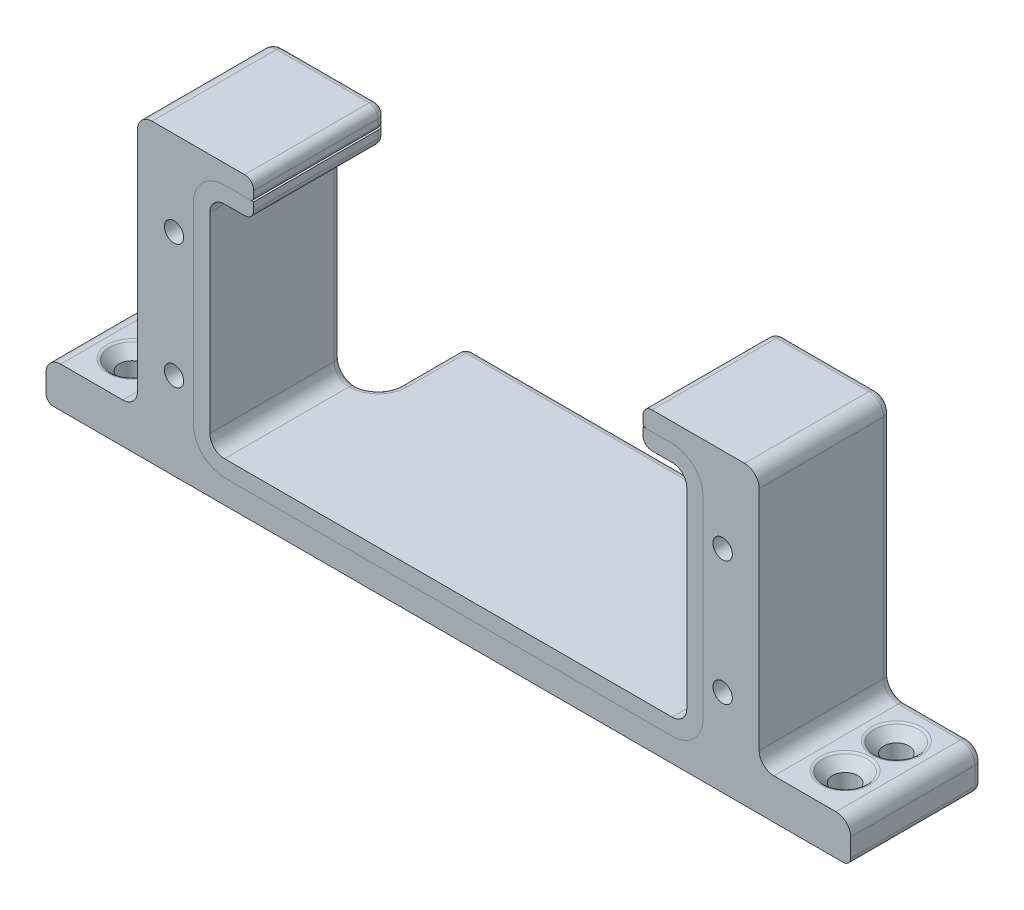
from build123d import *

# Parameters (mm, degrees)
SKETCH1_R                           = 1.325
BOSS_EXTRUDE1_DEPTH                 = 9
SKETCH2_W                           = 18
SKETCH2_H                           = 5.5
BOSS_EXTRUDE2_DEPTH                 = 55
TAP_DRILL_FOR_8_32_TAP1_D           = 3.4544
TAP_DRILL_FOR_8_32_TAP1_CSINK_D     = 6.35
TAP_DRILL_FOR_8_32_TAP1_CSINK_ANGLE = 90
MIRROR2_COPY_1_D                    = 3.4544
MIRROR2_COPY_1_CSINK_D              = 6.35
MIRROR2_COPY_1_CSINK_ANGLE          = 90
SKETCH6_W                           = 18
SKETCH6_H                           = 4.85
BOSS_EXTRUDE3_DEPTH                 = 6
SKETCH7_W                           = 55.2
SKETCH7_H                           = 5.5
BOSS_EXTRUDE4_DEPTH                 = 12
SKETCH9_R                           = 1.7272
BOSS_EXTRUDE5_DEPTH                 = 5
FILLET4_R                           = 3
FILLET1_R                           = 2
FILLET5_R                           = 1.25
FILLET2_R                           = 1
FILLET6_R                           = 1
SPLIT1_SURFACE_1_BACK               = 123.798
SPLIT1_SURFACE_1_DEPTH              = 247.596
SPLIT1_SURFACE_2_BACK               = 123.798
SPLIT1_SURFACE_2_DEPTH              = 247.596
FILLET7_R                           = 2
FILLET8_R                           = 0.5
FILLET9_R                           = 0.5
FILLET10_R                          = 0.5
CHAMFER1_SIZE                       = 0.5


with BuildPart() as part:
    # Sketch1 → Boss-Extrude1 (new, symmetric)
    with BuildSketch(Plane.XY):
        Polygon((-42.5, -20.25), (42.5, -20.25), (42.5, 20.25), (32.6, 20.25), (32.6, -14.75), (-32.6, -14.75), (-32.6, 20.25), (-42.5, 20.25), align=None)
        with Locations((-37.5, 8.649817683)):
            Circle(SKETCH1_R, mode=Mode.SUBTRACT)
        with Locations((-37.5, -8.350182317)):
            Circle(SKETCH1_R, mode=Mode.SUBTRACT)
        with Locations(Location((37.5, -8.350182317, 0), (0, 0, 180))):
            Circle(SKETCH1_R, mode=Mode.SUBTRACT)
        with Locations(Location((37.5, 8.649817683, 0), (0, 0, 180))):
            Circle(SKETCH1_R, mode=Mode.SUBTRACT)
    extrude(amount=BOSS_EXTRUDE1_DEPTH, both=True)

    # Sketch2 → Boss-Extrude2 (add, symmetric)
    with BuildSketch(Plane(origin=(0, 0, 0), x_dir=(0, 0, -1), z_dir=(1, 0, 0))):
        with Locations((0, -17.5)):
            Rectangle(SKETCH2_W, SKETCH2_H)
    extrude(amount=BOSS_EXTRUDE2_DEPTH, both=True)

    # Tap Drill for #8-32 Tap1 (through all)
    with Locations(Plane(origin=(-48.75, -14.75, -3.5), x_dir=(0, 0, 1), z_dir=(0, 1, 0))):
        with Locations((0, 0)):
            tap_drill_for_8_32_tap1 = CounterSinkHole(TAP_DRILL_FOR_8_32_TAP1_D / 2, TAP_DRILL_FOR_8_32_TAP1_CSINK_D / 2, counter_sink_angle=TAP_DRILL_FOR_8_32_TAP1_CSINK_ANGLE)

    # Mirror1: Tap Drill for #8-32 Tap1 across plane
    add(tap_drill_for_8_32_tap1.mirror(Plane.XY), mode=Mode.SUBTRACT)

    # Mirror2: Tap Drill for #8-32 Tap1 across plane
    add(tap_drill_for_8_32_tap1.mirror(Plane(origin=(0, 0, 0), x_dir=(0, 0, 1), z_dir=(1, 0, 0))), mode=Mode.SUBTRACT)

    # Mirror2 copy 1 (through all)
    with Locations(Plane(origin=(48.75, -14.75, 3.5), x_dir=(0, 0, -1), z_dir=(0, 1, 0))):
        with Locations((0, 0)):
            CounterSinkHole(MIRROR2_COPY_1_D / 2, MIRROR2_COPY_1_CSINK_D / 2, counter_sink_angle=MIRROR2_COPY_1_CSINK_ANGLE)

    # Sketch6 → Boss-Extrude3 (add)
    with BuildSketch(Plane(origin=(-32.6, 0, 0), x_dir=(0, 0, -1), z_dir=(1, 0, 0))):
        with Locations((0, 17.825)):
            Rectangle(SKETCH6_W, SKETCH6_H)
    boss_extrude3 = extrude(amount=BOSS_EXTRUDE3_DEPTH)

    # Mirror3: Boss-Extrude3 across plane
    add(boss_extrude3.mirror(Plane(origin=(0, 0, 0), x_dir=(0, 0, 1), z_dir=(1, 0, 0))))

    # Sketch7 → Boss-Extrude4 (add)
    with BuildSketch(Plane(origin=(0, 0, -9), x_dir=(-1, 0, 0), z_dir=(0, 0, -1))):
        with Locations((0, -17.5)):
            Rectangle(SKETCH7_W, SKETCH7_H)
    extrude(amount=BOSS_EXTRUDE4_DEPTH)

    # Fillet4
    fillet4_edges = [part.edges().sort_by_distance(p)[0] for p in [
        (27.6, -17.5, -9),
        (-27.6, -17.5, -9),
    ]]
    fillet(fillet4_edges, radius=FILLET4_R)

    # Fillet1
    fillet1_edges = [part.edges().sort_by_distance(p)[0] for p in [
        (32.6, 15.4, 0),
        (42.5, 20.25, 0),
        (-42.5, 20.25, 0),
        (-32.6, -14.75, 0),
        (32.6, -14.75, 0),
        (-42.5, -14.75, 0),
        (-55, -14.75, 0),
        (42.5, -14.75, 0),
        (55, -14.75, 0),
        (-32.6, 15.4, 0),
    ]]
    fillet(fillet1_edges, radius=FILLET1_R)

    # Fillet5
    fillet5_edges = [part.edges().sort_by_distance(p)[0] for p in [
        (26.6, 20.25, 0),
        (26.6, 15.4, 0),
        (-26.6, 15.4, 0),
        (-26.6, 20.25, 0),
    ]]
    fillet(fillet5_edges, radius=FILLET5_R)

    # Fillet2
    fillet2_edges = [part.edges().sort_by_distance(p)[0] for p in [
        (-27.6, -20.25, -16.5),
        (0, -14.75, -21),
        (-28.478679656, -20.25, -9.878679656),
        (-42.8, -20.25, -9),
        (-55, -20.25, 0),
        (55, -20.25, 0),
    ]]
    fillet(fillet2_edges, radius=FILLET2_R)

    # Fillet6
    # the kernel refuses this fillet: 1 mm, written as the material it takes off along each edge
    with BuildSketch(Plane(origin=(-54, -19.25, -8), x_dir=(-1, 0, 0), z_dir=(0, 0, -1))) as fillet6_piece_1_section:
        Polygon((0, 0), (FILLET6_R, 0), (FILLET6_R, -FILLET6_R), (0, -FILLET6_R), align=None)
    fillet6_piece_1 = extrude(amount=FILLET6_R, mode=Mode.PRIVATE)
    fillet6_piece_1 = fillet6_piece_1 - Plane(origin=(-54, -19.25, -8), x_dir=(0.7071067811865475, 0.7071067811865475, 0), z_dir=(0, 0, -1)) * Sphere(FILLET6_R, mode=Mode.PRIVATE)
    add(fillet6_piece_1, mode=Mode.SUBTRACT)
    with BuildSketch(Plane(origin=(26.6, -19.25, -20), x_dir=(0, -1, 0), z_dir=(0, 0, -1))) as fillet6_piece_2_section:
        Polygon((0, 0), (FILLET6_R, 0), (FILLET6_R, -FILLET6_R), (0, -FILLET6_R), align=None)
    fillet6_piece_2 = extrude(amount=FILLET6_R, mode=Mode.PRIVATE)
    fillet6_piece_2 = fillet6_piece_2 - Plane(origin=(26.6, -19.25, -20), x_dir=(-0.7071067811865475, 0.7071067811865475, 0), z_dir=(0, 0, -1)) * Sphere(FILLET6_R, mode=Mode.PRIVATE)
    add(fillet6_piece_2, mode=Mode.SUBTRACT)
    with BuildSketch(Plane(origin=(27.6, -20.25, -12), x_dir=(-1, 0, 0), z_dir=(0, 0, -1)), Plane(origin=(-27.6, -14.75, -12), x_dir=(1, 0, 0), z_dir=(0, 0, -1))) as fillet6_piece_3:
        with BuildLine():
            CenterArc((FILLET6_R, FILLET6_R), FILLET6_R, 180, 90)
            Line((0, FILLET6_R), (0, 0))
            Line((0, 0), (FILLET6_R, 0))
        make_face()
    extrude(amount=8, mode=Mode.SUBTRACT)
    with BuildSketch(Plane(origin=(-26.6, -20.25, -21), x_dir=(0, 0, 1), z_dir=(1, 0, 0))) as fillet6_piece_4:
        with BuildLine():
            CenterArc((FILLET6_R, -FILLET6_R), FILLET6_R, 90, 90)
            Line((0, -FILLET6_R), (0, 0))
            Line((0, 0), (FILLET6_R, 0))
        make_face()
    extrude(amount=53.2, mode=Mode.SUBTRACT)
    with BuildSketch(Plane(origin=(30.6, -20.25, -9), x_dir=(0, 0, 1), z_dir=(1, 0, 0))) as fillet6_piece_5:
        with BuildLine():
            CenterArc((FILLET6_R, -FILLET6_R), FILLET6_R, 90, 90)
            Line((0, -FILLET6_R), (0, 0))
            Line((0, 0), (FILLET6_R, 0))
        make_face()
    extrude(amount=23.4, mode=Mode.SUBTRACT)
    with BuildSketch(Plane(origin=(30.6, -20.25, -12), x_dir=(0, 0, 1), z_dir=(1, 0, 0))) as fillet6_piece_6:
        with BuildLine():
            CenterArc((3 + FILLET6_R, -FILLET6_R), FILLET6_R, 90, 90)
            Line((3, -FILLET6_R), (3, 0))
            Line((3, 0), (3 + FILLET6_R, 0))
        make_face()
    revolve(axis=Axis((30.6, -20.25, -12), (0, -1, 0)), revolution_arc=90, mode=Mode.SUBTRACT)
    with BuildSketch(Plane(origin=(30.6, -14.75, -12), x_dir=(0, 0, 1), z_dir=(1, 0, 0))) as fillet6_piece_7:
        with BuildLine():
            CenterArc((3 + FILLET6_R, FILLET6_R), FILLET6_R, 180, 90)
            Line((3, FILLET6_R), (3, 0))
            Line((3, 0), (3 + FILLET6_R, 0))
        make_face()
    revolve(axis=Axis((30.6, -14.75, -12), (0, -1, 0)), revolution_arc=90, mode=Mode.SUBTRACT)
    with BuildSketch(Plane(origin=(-30.6, -14.75, -12), x_dir=(0, 0, 1), z_dir=(-1, 0, 0))) as fillet6_piece_8:
        with BuildLine():
            CenterArc((3 + FILLET6_R, -FILLET6_R), FILLET6_R, 90, 90)
            Line((3 + FILLET6_R, 0), (3, 0))
            Line((3, 0), (3, -FILLET6_R))
        make_face()
    revolve(axis=Axis((-30.6, -14.75, -12), (0, 1, 0)), revolution_arc=90, mode=Mode.SUBTRACT)
    with BuildSketch(Plane(origin=(-32.6, -12.75, -9), x_dir=(-1, 0, 0), z_dir=(0, 1, 0))) as fillet6_piece_9:
        with BuildLine():
            CenterArc((FILLET6_R, FILLET6_R), FILLET6_R, 180, 90)
            Line((0, FILLET6_R), (0, 0))
            Line((0, 0), (FILLET6_R, 0))
        make_face()
    extrude(amount=26.15, mode=Mode.SUBTRACT)
    with BuildSketch(Plane(origin=(32.6, 13.4, -9), x_dir=(0, 0, 1), z_dir=(0, -1, 0))) as fillet6_piece_10:
        with BuildLine():
            CenterArc((FILLET6_R, -FILLET6_R), FILLET6_R, 90, 90)
            Line((0, -FILLET6_R), (0, 0))
            Line((0, 0), (FILLET6_R, 0))
        make_face()
    extrude(amount=26.15, mode=Mode.SUBTRACT)
    with BuildSketch(Plane(origin=(44.5, -14.75, -9), x_dir=(0, 0, 1), z_dir=(1, 0, 0))) as fillet6_piece_11:
        with BuildLine():
            CenterArc((FILLET6_R, FILLET6_R), FILLET6_R, 180, 90)
            Line((0, FILLET6_R), (0, 0))
            Line((0, 0), (FILLET6_R, 0))
        make_face()
    extrude(amount=8.5, mode=Mode.SUBTRACT)
    with BuildSketch(Plane(origin=(27.85, 20.25, -9), x_dir=(0, 0, 1), z_dir=(1, 0, 0))) as fillet6_piece_12:
        with BuildLine():
            CenterArc((FILLET6_R, FILLET6_R), FILLET6_R, 180, 90)
            Line((0, FILLET6_R), (0, 0))
            Line((0, 0), (FILLET6_R, 0))
        make_face()
    extrude(amount=12.65, mode=Mode.SUBTRACT)
    with BuildSketch(Plane(origin=(42.5, -12.75, -9), x_dir=(0, 0, 1), z_dir=(0, 1, 0))) as fillet6_piece_13:
        with BuildLine():
            CenterArc((FILLET6_R, -FILLET6_R), FILLET6_R, 90, 90)
            Line((0, -FILLET6_R), (0, 0))
            Line((0, 0), (FILLET6_R, 0))
        make_face()
    extrude(amount=31, mode=Mode.SUBTRACT)
    with BuildSketch(Plane(origin=(40.5, 18.25, -9), x_dir=(1, 0, 0), z_dir=(0, -1, 0))) as fillet6_piece_14:
        with BuildLine():
            CenterArc((2 - FILLET6_R, FILLET6_R), FILLET6_R, 270, 90)
            Line((2 - FILLET6_R, 0), (2, 0))
            Line((2, 0), (2, FILLET6_R))
        make_face()
    revolve(axis=Axis((40.5, 18.25, -9), (0, 0, 1)), revolution_arc=90, mode=Mode.SUBTRACT)
    with BuildSketch(Plane(origin=(53, -16.75, -9), x_dir=(1, 0, 0), z_dir=(0, -1, 0))) as fillet6_piece_15:
        with BuildLine():
            CenterArc((2 - FILLET6_R, FILLET6_R), FILLET6_R, 270, 90)
            Line((2 - FILLET6_R, 0), (2, 0))
            Line((2, 0), (2, FILLET6_R))
        make_face()
    revolve(axis=Axis((53, -16.75, -9), (0, 0, 1)), revolution_arc=90, mode=Mode.SUBTRACT)
    with BuildSketch(Plane(origin=(-53, -14.75, -9), x_dir=(0, -1, 0), z_dir=(1, 0, 0))) as fillet6_piece_16:
        with BuildLine():
            CenterArc((FILLET6_R, -FILLET6_R), FILLET6_R, 90, 90)
            Line((0, -FILLET6_R), (0, 0))
            Line((0, 0), (FILLET6_R, 0))
        make_face()
    extrude(amount=8.5, mode=Mode.SUBTRACT)
    with BuildSketch(Plane(origin=(-42.5, 18.25, -9), x_dir=(1, 0, 0), z_dir=(0, -1, 0))) as fillet6_piece_17:
        with BuildLine():
            CenterArc((FILLET6_R, FILLET6_R), FILLET6_R, 180, 90)
            Line((0, FILLET6_R), (0, 0))
            Line((0, 0), (FILLET6_R, 0))
        make_face()
    extrude(amount=31, mode=Mode.SUBTRACT)
    with BuildSketch(Plane(origin=(-40.5, 18.25, -9), x_dir=(-1, 0, 0), z_dir=(0, -1, 0))) as fillet6_piece_18:
        with BuildLine():
            CenterArc((2 - FILLET6_R, -FILLET6_R), FILLET6_R, 0, 90)
            Line((2, -FILLET6_R), (2, 0))
            Line((2, 0), (2 - FILLET6_R, 0))
        make_face()
    revolve(axis=Axis((-40.5, 18.25, -9), (0, 0, -1)), revolution_arc=90, mode=Mode.SUBTRACT)
    with BuildSketch(Plane(origin=(-53, -16.75, -9), x_dir=(-1, 0, 0), z_dir=(0, -1, 0))) as fillet6_piece_19:
        with BuildLine():
            CenterArc((2 - FILLET6_R, -FILLET6_R), FILLET6_R, 0, 90)
            Line((2, -FILLET6_R), (2, 0))
            Line((2, 0), (2 - FILLET6_R, 0))
        make_face()
    revolve(axis=Axis((-53, -16.75, -9), (0, 0, -1)), revolution_arc=90, mode=Mode.SUBTRACT)
    with BuildSketch(Plane(origin=(-30.6, -12.75, -9), x_dir=(0, -1, 0), z_dir=(1, 0, 0))) as fillet6_piece_20:
        with BuildLine():
            CenterArc((2 + FILLET6_R, -FILLET6_R), FILLET6_R, 90, 90)
            Line((2, -FILLET6_R), (2, 0))
            Line((2, 0), (2 + FILLET6_R, 0))
        make_face()
    revolve(axis=Axis((-30.6, -12.75, -9), (0, 0, -1)), revolution_arc=90, mode=Mode.SUBTRACT)
    with BuildSketch(Plane(origin=(-30.6, 13.4, -9), x_dir=(-1, 0, 0), z_dir=(0, -1, 0))) as fillet6_piece_21:
        with BuildLine():
            CenterArc((2 + FILLET6_R, -FILLET6_R), FILLET6_R, 90, 90)
            Line((2, -FILLET6_R), (2, 0))
            Line((2, 0), (2 + FILLET6_R, 0))
        make_face()
    revolve(axis=Axis((-30.6, 13.4, -9), (0, 0, -1)), revolution_arc=90, mode=Mode.SUBTRACT)
    with BuildSketch(Plane(origin=(30.6, 13.4, -9), x_dir=(0, 1, 0), z_dir=(-1, 0, 0))) as fillet6_piece_22:
        with BuildLine():
            CenterArc((2 + FILLET6_R, -FILLET6_R), FILLET6_R, 90, 90)
            Line((2 + FILLET6_R, 0), (2, 0))
            Line((2, 0), (2, -FILLET6_R))
        make_face()
    revolve(axis=Axis((30.6, 13.4, -9), (0, 0, -1)), revolution_arc=90, mode=Mode.SUBTRACT)
    with BuildSketch(Plane(origin=(30.6, -12.75, -9), x_dir=(0, -1, 0), z_dir=(-1, 0, 0))) as fillet6_piece_23:
        with BuildLine():
            CenterArc((2 + FILLET6_R, FILLET6_R), FILLET6_R, 180, 90)
            Line((2 + FILLET6_R, 0), (2, 0))
            Line((2, 0), (2, FILLET6_R))
        make_face()
    revolve(axis=Axis((30.6, -12.75, -9), (0, 0, 1)), revolution_arc=90, mode=Mode.SUBTRACT)
    with BuildSketch(Plane(origin=(44.5, -12.75, -9), x_dir=(0, -1, 0), z_dir=(1, 0, 0))) as fillet6_piece_24:
        with BuildLine():
            CenterArc((2 + FILLET6_R, -FILLET6_R), FILLET6_R, 90, 90)
            Line((2 + FILLET6_R, 0), (2, 0))
            Line((2, 0), (2, -FILLET6_R))
        make_face()
    revolve(axis=Axis((44.5, -12.75, -9), (0, 0, -1)), revolution_arc=90, mode=Mode.SUBTRACT)
    with BuildSketch(Plane(origin=(-44.5, -12.75, -9), x_dir=(0, -1, 0), z_dir=(-1, 0, 0))) as fillet6_piece_25:
        with BuildLine():
            CenterArc((2 + FILLET6_R, FILLET6_R), FILLET6_R, 180, 90)
            Line((2, FILLET6_R), (2, 0))
            Line((2, 0), (2 + FILLET6_R, 0))
        make_face()
    revolve(axis=Axis((-44.5, -12.75, -9), (0, 0, 1)), revolution_arc=90, mode=Mode.SUBTRACT)
    with BuildSketch(Plane(origin=(-26.6, 19, -9), x_dir=(-1, 0, 0), z_dir=(0, -1, 0)), Plane(origin=(26.6, 19, -9), x_dir=(0, 0, 1), z_dir=(0, -1, 0))) as fillet6_piece_26:
        with BuildLine():
            CenterArc((FILLET6_R, -FILLET6_R), FILLET6_R, 90, 90)
            Line((0, -FILLET6_R), (0, 0))
            Line((0, 0), (FILLET6_R, 0))
        make_face()
    extrude(amount=2.35, mode=Mode.SUBTRACT)
    with BuildSketch(Plane(origin=(-40.5, 20.25, -9), x_dir=(0, -1, 0), z_dir=(1, 0, 0))) as fillet6_piece_27:
        with BuildLine():
            CenterArc((FILLET6_R, -FILLET6_R), FILLET6_R, 90, 90)
            Line((0, -FILLET6_R), (0, 0))
            Line((0, 0), (FILLET6_R, 0))
        make_face()
    extrude(amount=12.65, mode=Mode.SUBTRACT)
    with BuildSketch(Plane(origin=(-30.6, 15.4, -9), x_dir=(0, 1, 0), z_dir=(1, 0, 0)), Plane(origin=(30.6, 15.4, -9), x_dir=(0, 0, 1), z_dir=(-1, 0, 0))) as fillet6_piece_28:
        with BuildLine():
            CenterArc((FILLET6_R, FILLET6_R), FILLET6_R, 180, 90)
            Line((0, FILLET6_R), (0, 0))
            Line((0, 0), (FILLET6_R, 0))
        make_face()
    extrude(amount=2.75, mode=Mode.SUBTRACT)
    with BuildSketch(Plane(origin=(-27.85, 19, -9), x_dir=(0, 1, 0), z_dir=(-1, 0, 0))) as fillet6_piece_29:
        with BuildLine():
            CenterArc((1.25 - FILLET6_R, -FILLET6_R), FILLET6_R, 0, 90)
            Line((1.25, -FILLET6_R), (1.25, 0))
            Line((1.25, 0), (1.25 - FILLET6_R, 0))
        make_face()
    revolve(axis=Axis((-27.85, 19, -9), (0, 0, -1)), revolution_arc=90, mode=Mode.SUBTRACT)
    with BuildSketch(Plane(origin=(-27.85, 16.65, -9), x_dir=(0, -1, 0), z_dir=(-1, 0, 0))) as fillet6_piece_30:
        with BuildLine():
            CenterArc((1.25 - FILLET6_R, FILLET6_R), FILLET6_R, 270, 90)
            Line((1.25, FILLET6_R), (1.25, 0))
            Line((1.25, 0), (1.25 - FILLET6_R, 0))
        make_face()
    revolve(axis=Axis((-27.85, 16.65, -9), (0, 0, 1)), revolution_arc=90, mode=Mode.SUBTRACT)
    with BuildSketch(Plane(origin=(27.85, 19, -9), x_dir=(-1, 0, 0), z_dir=(0, -1, 0))) as fillet6_piece_31:
        with BuildLine():
            CenterArc((1.25 - FILLET6_R, -FILLET6_R), FILLET6_R, 0, 90)
            Line((1.25 - FILLET6_R, 0), (1.25, 0))
            Line((1.25, 0), (1.25, -FILLET6_R))
        make_face()
    revolve(axis=Axis((27.85, 19, -9), (0, 0, -1)), revolution_arc=90, mode=Mode.SUBTRACT)
    with BuildSketch(Plane(origin=(27.85, 16.65, -9), x_dir=(0, -1, 0), z_dir=(1, 0, 0))) as fillet6_piece_32:
        with BuildLine():
            CenterArc((1.25 - FILLET6_R, -FILLET6_R), FILLET6_R, 0, 90)
            Line((1.25 - FILLET6_R, 0), (1.25, 0))
            Line((1.25, 0), (1.25, -FILLET6_R))
        make_face()
    revolve(axis=Axis((27.85, 16.65, -9), (0, 0, -1)), revolution_arc=90, mode=Mode.SUBTRACT)
    with BuildSketch(Plane(origin=(-27.6, -15.75, -21), x_dir=(0, 0, 1), z_dir=(0, -1, 0)), Plane(origin=(27.6, -19.25, -21), x_dir=(0, 0, 1), z_dir=(0, 1, 0))) as fillet6_piece_33:
        with BuildLine():
            CenterArc((FILLET6_R, -FILLET6_R), FILLET6_R, 90, 90)
            Line((0, -FILLET6_R), (0, 0))
            Line((0, 0), (FILLET6_R, 0))
        make_face()
    extrude(amount=3.5, mode=Mode.SUBTRACT)
    with BuildSketch(Plane(origin=(-27.6, -15.75, -20), x_dir=(0, 1, 0), z_dir=(0, 0, 1))) as fillet6_piece_34:
        with BuildLine():
            CenterArc((1 - FILLET6_R, -FILLET6_R), FILLET6_R, 0, 90)
            Line((1, -FILLET6_R), (1, 0))
            Line((1, 0), (1 - FILLET6_R, 0))
        make_face()
    revolve(axis=Axis((-27.6, -15.75, -20), (-1, 0, 0)), revolution_arc=90, mode=Mode.SUBTRACT)
    with BuildSketch(Plane(origin=(-26.6, -19.25, -21), x_dir=(0, -1, 0), z_dir=(1, 0, 0))) as fillet6_piece_35:
        with BuildLine():
            CenterArc((1 - FILLET6_R, -FILLET6_R), FILLET6_R, 0, 90)
            Line((1 - FILLET6_R, 0), (1, 0))
            Line((1, 0), (1, -FILLET6_R))
        make_face()
    revolve(axis=Axis((-26.6, -19.25, -21), (0, 0, -1)), revolution_arc=90, mode=Mode.SUBTRACT)
    with BuildSketch(Plane(origin=(27.6, -14.75, -12), x_dir=(-1, 0, 0), z_dir=(0, 0, -1))) as fillet6_piece_36:
        with BuildLine():
            CenterArc((FILLET6_R, -FILLET6_R), FILLET6_R, 90, 90)
            Line((0, -FILLET6_R), (0, 0))
            Line((0, 0), (FILLET6_R, 0))
        make_face()
    extrude(amount=8, mode=Mode.SUBTRACT)
    with BuildSketch(Plane(origin=(27.6, -15.75, -20), x_dir=(0, 1, 0), z_dir=(0, 0, 1))) as fillet6_piece_37:
        with BuildLine():
            CenterArc((1 - FILLET6_R, FILLET6_R), FILLET6_R, 270, 90)
            Line((1, FILLET6_R), (1, 0))
            Line((1, 0), (1 - FILLET6_R, 0))
        make_face()
    revolve(axis=Axis((27.6, -15.75, -20), (-1, 0, 0)), revolution_arc=90, mode=Mode.SUBTRACT)
    with BuildSketch(Plane(origin=(-55, -16.75, -9), x_dir=(1, 0, 0), z_dir=(0, -1, 0)), Plane(origin=(55, -16.75, -9), x_dir=(0, 0, 1), z_dir=(0, -1, 0))) as fillet6_piece_38:
        with BuildLine():
            CenterArc((FILLET6_R, FILLET6_R), FILLET6_R, 180, 90)
            Line((0, FILLET6_R), (0, 0))
            Line((0, 0), (FILLET6_R, 0))
        make_face()
    extrude(amount=2.5, mode=Mode.SUBTRACT)
    with BuildSketch(Plane(origin=(54, -19.25, -9), x_dir=(0, -1, 0), z_dir=(-1, 0, 0))) as fillet6_piece_39:
        with BuildLine():
            CenterArc((1 - FILLET6_R, FILLET6_R), FILLET6_R, 270, 90)
            Line((1 - FILLET6_R, 0), (1, 0))
            Line((1, 0), (1, FILLET6_R))
        make_face()
    revolve(axis=Axis((54, -19.25, -9), (0, 0, 1)), revolution_arc=90, mode=Mode.SUBTRACT)


with BuildPart() as body_2:
    # Sketch9 → Boss-Extrude5 (new body)
    with BuildSketch(Plane(origin=(0, -20.35, 0), x_dir=(-1, 0, 0), z_dir=(0, -1, 0))):
        Polygon((-55, -9), (55, -9), (55, 9), (27.6, 9), (27.6, 21), (-27.6, 21), (-27.6, 9), (-55, 9), align=None)
        with Locations(Location((-48.75, -3.5, 0), (0, 0, 90))):
            Circle(SKETCH9_R, mode=Mode.SUBTRACT)
        with Locations(Location((-48.75, 3.5, 0), (0, 0, 90))):
            Circle(SKETCH9_R, mode=Mode.SUBTRACT)
        with Locations(Location((48.75, -3.5, 0), (0, 0, 90))):
            Circle(SKETCH9_R, mode=Mode.SUBTRACT)
        with Locations(Location((48.75, 3.5, 0), (0, 0, 90))):
            Circle(SKETCH9_R, mode=Mode.SUBTRACT)
    extrude(amount=BOSS_EXTRUDE5_DEPTH)

    # Fillet7
    fillet7_edges = [body_2.edges().sort_by_distance(p)[0] for p in [
        (55, -22.85, -9),
        (27.6, -22.85, -9),
        (27.6, -22.85, -21),
        (-27.6, -22.85, -21),
        (-27.6, -22.85, -9),
        (-55, -22.85, -9),
        (-55, -22.85, 9),
        (55, -22.85, 9),
    ]]
    fillet(fillet7_edges, radius=FILLET7_R)

    # Fillet8
    fillet8_edges = [body_2.edges().sort_by_distance(p)[0] for p in [
        (48.75, -20.35, 5.2272),
        (48.75, -25.35, 5.2272),
        (48.75, -20.35, -1.7728),
        (48.75, -25.35, -1.7728),
        (-48.75, -20.35, 5.2272),
        (-48.75, -25.35, 5.2272),
        (-48.75, -20.35, -1.7728),
        (-48.75, -25.35, -1.7728),
        (-55, -20.35, 0),
        (-55, -25.35, 0),
        (55, -20.35, 0),
        (41.3, -20.35, -9),
        (27.6, -20.35, -15),
        (0, -20.35, -21),
        (-27.6, -20.35, -15),
        (-41.3, -20.35, -9),
        (0, -20.35, 9),
        (54.414213562, -20.35, -8.414213562),
        (54.414213562, -20.35, 8.414213562),
        (27.014213562, -20.35, -20.414213562),
        (-27.014213562, -20.35, -20.414213562),
        (-54.414213562, -20.35, -8.414213562),
        (-54.414213562, -20.35, 8.414213562),
        (0, -25.35, 9),
        (55, -25.35, 0),
        (-41.3, -25.35, -9),
        (-27.6, -25.35, -15),
        (0, -25.35, -21),
        (27.6, -25.35, -15),
        (41.3, -25.35, -9),
        (54.414213562, -25.35, -8.414213562),
        (54.414213562, -25.35, 8.414213562),
        (27.014213562, -25.35, -20.414213562),
        (-27.014213562, -25.35, -20.414213562),
        (-54.414213562, -25.35, -8.414213562),
        (-54.414213562, -25.35, 8.414213562),
        (-28.185786438, -20.35, -9.585786438),
        (-28.185786438, -25.35, -9.585786438),
        (28.185786438, -20.35, -9.585786438),
        (28.185786438, -25.35, -9.585786438),
    ]]
    fillet(fillet8_edges, radius=FILLET8_R)


with BuildPart() as body_3:
    # Split1: the piece behind the surface
    add(part.part)
    # Split1 surface: a surface, the sketch's curves swept straight by 247.596 mm
    with BuildLine(Plane.XY.offset(9).offset(-SPLIT1_SURFACE_1_BACK), mode=Mode.PRIVATE) as split1_surface_1_path:
        Line((-27.85, 17.65), (27.85, 17.65))
        Line((27.85, 17.65), (30.6, 17.65))
        ThreePointArc((30.6, 17.65), (33.60520382, 16.40520382), (34.85, 13.4))
        Line((34.85, 13.4), (34.85, -12.75))
        ThreePointArc((34.85, -12.75), (33.60520382, -15.75520382), (30.6, -17))
        Line((30.6, -17), (-30.6, -17))
        ThreePointArc((-30.6, -17), (-33.60520382, -15.75520382), (-34.85, -12.75))
        Line((-34.85, -12.75), (-34.85, 13.4))
        ThreePointArc((-34.85, 13.4), (-33.60520382, 16.40520382), (-30.6, 17.65))
        Line((-30.6, 17.65), (-27.85, 17.65))
    split1_surface_1 = Shell.extrude(split1_surface_1_path.wire(), (0 * SPLIT1_SURFACE_1_DEPTH, 0 * SPLIT1_SURFACE_1_DEPTH, 1 * SPLIT1_SURFACE_1_DEPTH))
    split(bisect_by=split1_surface_1, keep=Keep.BOTTOM)


with BuildPart() as part_1:
    add(part.part)

    # Split1: split by a surface, the side it looks to stays
    # Split1 surface: a surface, the sketch's curves swept straight by 247.596 mm
    with BuildLine(Plane.XY.offset(9).offset(-SPLIT1_SURFACE_2_BACK), mode=Mode.PRIVATE) as split1_surface_2_path:
        Line((-27.85, 17.65), (27.85, 17.65))
        Line((27.85, 17.65), (30.6, 17.65))
        ThreePointArc((30.6, 17.65), (33.60520382, 16.40520382), (34.85, 13.4))
        Line((34.85, 13.4), (34.85, -12.75))
        ThreePointArc((34.85, -12.75), (33.60520382, -15.75520382), (30.6, -17))
        Line((30.6, -17), (-30.6, -17))
        ThreePointArc((-30.6, -17), (-33.60520382, -15.75520382), (-34.85, -12.75))
        Line((-34.85, -12.75), (-34.85, 13.4))
        ThreePointArc((-34.85, 13.4), (-33.60520382, 16.40520382), (-30.6, 17.65))
        Line((-30.6, 17.65), (-27.85, 17.65))
    split1_surface_2 = Shell.extrude(split1_surface_2_path.wire(), (0 * SPLIT1_SURFACE_2_DEPTH, 0 * SPLIT1_SURFACE_2_DEPTH, 1 * SPLIT1_SURFACE_2_DEPTH))
    split(bisect_by=split1_surface_2, keep=Keep.TOP)

    # Fillet9
    fillet9_edges = [part_1.edges().sort_by_distance(p)[0] for p in [
        (-28.478679656, -17, -9.878679656),
        (28.478679656, -17, -9.878679656),
        (-27.6, -17, -16),
        (27.6, -17, -16),
        (-33.60520382, -15.75520382, -9),
        (-34.85, 0.325, -9),
        (-33.60520382, 16.40520382, -9),
        (-29.225, 17.65, -9),
        (29.225, 17.65, -9),
        (33.60520382, 16.40520382, -9),
        (34.85, 0.325, -9),
        (33.60520382, -15.75520382, -9),
        (-26.6, 17.65, 0.5),
        (26.6, 17.65, 0.5),
        (0, -17, -21),
        (26.892893219, 17.65, -8.707106781),
        (-26.892893219, 17.65, -8.707106781),
        (27.307106781, -17, -20.707106781),
        (-27.307106781, -17, -20.707106781),
    ]]
    fillet(fillet9_edges, radius=FILLET9_R)

    # Fillet10
    fillet10_edges = [part_1.edges().sort_by_distance(p)[0] for p in [
        (-48.75, -14.75, -0.325),
        (-48.75, -14.75, 0.325),
        (48.75, -14.75, 0.325),
        (48.75, -14.75, -0.325),
    ]]
    fillet(fillet10_edges, radius=FILLET10_R)

    # Chamfer1
    chamfer1_edges = [part_1.edges().sort_by_distance(p)[0] for p in [
        (-38.825, 8.649817683, -9),
        (-38.825, -8.350182317, -9),
        (38.825, -8.350182317, -9),
        (38.825, 8.649817683, -9),
    ]]
    chamfer(chamfer1_edges, length=CHAMFER1_SIZE)


solid = Compound([body_3.part, part_1.part])
